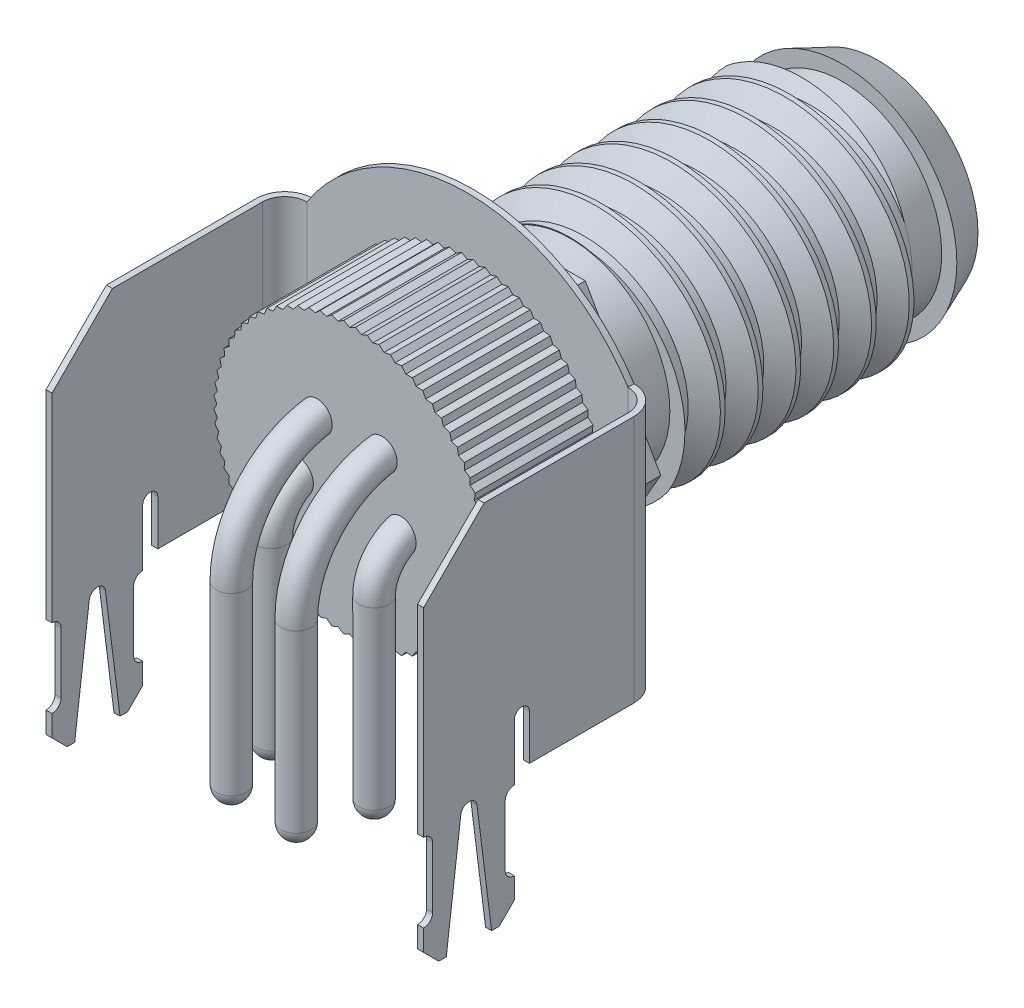
from build123d import *

# Parameters (mm, degrees)
SKETCH1_R           = 4
EXTRUDE1_DEPTH      = 8
THREAD_1_PITCH      = 1.25
SKETCH12_R          = 3.3
EXTRUDE2_DEPTH      = 1
EXTRUDE3_START      = 2
SKETCH14_R          = 3.3
EXTRUDE3_DEPTH      = 2
EXTRUDE4_DEPTH      = 1.2
BASE_FLANGE1_START  = -9
BASE_FLANGE1_DEPTH  = 15.3
EXTRUDE5_DEPTH      = 18.464893358
EXTRUDE5_DEPTH_BACK = 18.464893358
EXTRUDE6_DEPTH      = 23.019820617
EXTRUDE6_DEPTH_BACK = 23.019820617
EXTRUDE7_DEPTH      = 23.019820617
EXTRUDE7_DEPTH_BACK = 23.019820617
SKETCH28_R          = 0.5
SKETCH30_R          = 4.5
EXTRUDE8_DEPTH      = 3.9
EXTRUDE9_DEPTH      = 23.019820617
EXTRUDE9_DEPTH_BACK = 23.019820617
FILLET1_R           = 0.27
CHAMFER1_SIZE       = 2
FILLET2_R           = 0.5
FILLET3_R           = 0.5
FILLET4_R           = 0.5
FILLET5_R           = 0.5
EXTRUDE10_DEPTH     = 21.64733639
CIRPATTERN1_COUNT   = 72


# Read off the part's stored shape, not the designer's step: Base-Flange1
with BuildPart() as part:
    # Sketch1 → Extrude1 (new body)
    with BuildSketch(Plane.XY):
        Circle(SKETCH1_R)
    extrude(amount=EXTRUDE1_DEPTH)

    # 螺纹线1: the profile of Sketch5 profile screwed along a right-hand helix of 8 turns, 8 arcs to a turn; built about Z, then put on its axis
    thread_1_z = Axis((0, 0, 0), (0, 0, 1))
    thread_1_corners = [(4.0003, 0, -0.000173205), (4.0003, 0, 1.093923202), (3.323417656, 0, 0.703124998), (3.323417656, 0, 0.390624998)]
    with BuildLine(mode=Mode.PRIVATE) as thread_1_profile:
        Line(thread_1_corners[0], thread_1_corners[1])
        Line(thread_1_corners[1], thread_1_corners[2])
        Line(thread_1_corners[2], thread_1_corners[3])
        Line(thread_1_corners[3], thread_1_corners[0])
    thread_1_cap = Face(thread_1_profile.wire())
    thread_1_turn_angles = [0, 22.5, 45, 67.5, 90, 112.5, 135, 157.5, 180, 202.5, 225, 247.5, 270, 292.5, 315, 337.5, 360]
    thread_1_turn_weights = [1, 0.9238795325112867, 1, 0.9238795325112867, 1, 0.9238795325112867, 1, 0.9238795325112867, 1, 0.9238795325112867, 1, 0.9238795325112867, 1, 0.9238795325112867, 1, 0.9238795325112867, 1]
    thread_1_turn_rails = [Edge.make_bspline([Vector(p[0], p[1], 0).rotate(thread_1_z, thread_1_turn_angles[k]) / thread_1_turn_weights[k] + Vector(0, 0, p[2] + THREAD_1_PITCH * thread_1_turn_angles[k] / 360) for k in range(17)], [0, 0, 0, 1, 1, 2, 2, 3, 3, 4, 4, 5, 5, 6, 6, 7, 7, 8, 8, 8], 2, thread_1_turn_weights) for p in thread_1_corners]
    thread_1_turn_sides = [Face.make_surface_from_curves(thread_1_turn_rails[p[0]], thread_1_turn_rails[p[1]]) for p in [(0, 1), (1, 2), (2, 3), (3, 0)]]
    thread_1 = Plane(origin=(0, 0, 10), x_dir=(-1, 0, 0), z_dir=(0, 0, -1)) * Solid(Shell([*[p.moved(Location((0, 0, THREAD_1_PITCH * i))) for i in range(8) for p in thread_1_turn_sides], thread_1_cap, thread_1_cap.rotate(thread_1_z, 2880).moved(Location((0, 0, THREAD_1_PITCH * 2880 / 360)))]))
    add(thread_1, mode=Mode.SUBTRACT)

    # Sketch12 → Extrude2 (add)
    with BuildSketch(Plane(origin=(0, 0, 0), x_dir=(-1, 0, 0), z_dir=(0, 0, -1))):
        with Locations(Location((0, 0, 0), (0, 0, 180))):
            Circle(SKETCH12_R)
    extrude(amount=EXTRUDE2_DEPTH)

    # Sketch13 → Revolve1 (revolve)
    with BuildSketch(Plane(origin=(0, 0, 0), x_dir=(1, 0, 0), z_dir=(0, 1, 0)), mode=Mode.PRIVATE) as revolve1_sk:
        Polygon((0, 1), (-3.8, 1), (-3.3, 2.2), (0, 2.2), align=None)
    revolve(revolve1_sk.sketch.rotate(Axis((0, 0, -1), (0, 0, -1)), 180), axis=Axis((0, 0, -1), (0, 0, -1)))

    # Sketch14 → Extrude3 (add)
    with BuildSketch(Plane.XY.offset(8).offset(EXTRUDE3_START)):
        Circle(SKETCH14_R)
    extrude(amount=-EXTRUDE3_DEPTH)


with BuildPart() as body_2:
    # Sketch15 → Extrude4 (new body)
    with BuildSketch(Plane.XY.offset(10)):
        Polygon((2.5, 4.330127019), (-2.5, 4.330127019), (-5, 0), (-2.5, -4.330127019), (2.5, -4.330127019), (5, 0), align=None)
    extrude(amount=EXTRUDE4_DEPTH)


with BuildPart() as body_3:
    # Base-Flange1 outline → Base-Flange1 (new body)
    with BuildSketch(Plane(origin=(0, 0, 0), x_dir=(1, 0, 0), z_dir=(0, 1, 0)).offset(BASE_FLANGE1_START)):
        with BuildLine():
            Line((-6.25, -12.1366), (-6.25, -19.1))
            Line((-6.25, -19.1), (-6.05, -19.1))
            Line((-6.05, -19.1), (-6.05, -12.1366))
            ThreePointArc((-6.05, -12.1366), (-5.834254855, -11.615745145), (-5.3134, -11.4))
            Line((-5.3134, -11.4), (5.3134, -11.4))
            ThreePointArc((5.3134, -11.4), (5.834254855, -11.615745145), (6.05, -12.1366))
            Line((6.05, -12.1366), (6.05, -19.1))
            Line((6.05, -19.1), (6.25, -19.1))
            Line((6.25, -19.1), (6.25, -12.1366))
            ThreePointArc((6.25, -12.1366), (5.975676211, -11.474323789), (5.3134, -11.2))
            Line((5.3134, -11.2), (-5.3134, -11.2))
            ThreePointArc((-5.3134, -11.2), (-5.975676211, -11.474323789), (-6.25, -12.1366))
        make_face()
    extrude(amount=BASE_FLANGE1_DEPTH)

    # Sketch25 → Extrude5 (cut, two sides: drawn at the far end of the back side and taken through both)
    with BuildSketch(Plane.XY.offset(11.4).offset(-EXTRUDE5_DEPTH_BACK)):
        with BuildLine():
            Line((51.442987849, 3.384934333), (6.25, 3.384934333))
            Line((6.25, 3.384934333), (5.3134, 3.384934333))
            ThreePointArc((5.3134, 3.384934333), (0, 6.3), (-5.3134, 3.384934333))
            Line((-5.3134, 3.384934333), (-6.25, 3.384934333))
            Line((-6.25, 3.384934333), (-51.442987849, 3.384934333))
            Line((-51.442987849, 3.384934333), (-51.442987849, 93.770910031))
            Line((-51.442987849, 93.770910031), (51.442987849, 93.770910031))
            Line((51.442987849, 93.770910031), (51.442987849, 3.384934333))
        make_face()
    extrude(amount=EXTRUDE5_DEPTH + EXTRUDE5_DEPTH_BACK, mode=Mode.SUBTRACT)

    # Sketch26 → Extrude6 (cut, two sides: drawn at the far end of the back side and taken through both)
    with BuildSketch(Plane(origin=(0, 0, 0), x_dir=(0, 0, -1), z_dir=(1, 0, 0)).offset(-EXTRUDE6_DEPTH_BACK)):
        Polygon((46.506603317, -4.830127019), (-11.2, -4.830127019), (-16.1, -4.830127019), (-16.1, -9), (-16.1, -66.706603317), (65.029403958, -148.793314048), (127.636007275, -86.91683775), align=None)
    extrude(amount=EXTRUDE6_DEPTH + EXTRUDE6_DEPTH_BACK, mode=Mode.SUBTRACT)

    # Sketch27 → Extrude7 (cut, two sides: drawn at the far end of the back side and taken through both)
    with BuildSketch(Plane(origin=(0, 0, 0), x_dir=(0, 0, -1), z_dir=(1, 0, 0)).offset(-EXTRUDE7_DEPTH_BACK)):
        with BuildLine():
            Line((-16.1, -6.330127019), (-16.1, -3.330127019))
            ThreePointArc((-16.1, -3.330127019), (-15.85, -3.080127019), (-15.6, -3.330127019))
            Line((-15.6, -3.330127019), (-15.6, -6.330127019))
            ThreePointArc((-15.6, -6.330127019), (-15.85, -6.580127019), (-16.1, -6.330127019))
        make_face()
    extrude(amount=EXTRUDE7_DEPTH + EXTRUDE7_DEPTH_BACK, mode=Mode.SUBTRACT)

    # Sketch31 → Extrude9 (cut, two sides: drawn at the far end of the back side and taken through both)
    with BuildSketch(Plane(origin=(0, 0, 0), x_dir=(0, 0, -1), z_dir=(1, 0, 0)).offset(-EXTRUDE9_DEPTH_BACK)):
        Polygon((-19.1, -8.5), (-18.6, -9), (-19.1, -9), align=None)
        Polygon((-16.1, -8.5), (-16.6, -9), (-16.1, -9), align=None)
        with BuildLine():
            Line((-19.4, -7.5), (-19.4, -5.5))
            ThreePointArc((-19.4, -5.5), (-19.1, -5.2), (-18.8, -5.5))
            Line((-18.8, -5.5), (-18.8, -7.5))
            ThreePointArc((-18.8, -7.5), (-19.1, -7.8), (-19.4, -7.5))
        make_face()
        with BuildLine():
            Line((-15.8, -7.5), (-15.8, -5.5))
            ThreePointArc((-15.8, -5.5), (-16.1, -5.2), (-16.4, -5.5))
            Line((-16.4, -5.5), (-16.4, -7.5))
            ThreePointArc((-16.4, -7.5), (-16.1, -7.8), (-15.8, -7.5))
        make_face()
        Polygon((-18.35, -9), (-17.6, -3.030127019), (-16.85, -9), align=None)
    extrude(amount=EXTRUDE9_DEPTH + EXTRUDE9_DEPTH_BACK, mode=Mode.SUBTRACT)

    # Fillet1
    fillet1_edges = [body_3.edges().sort_by_distance(p)[0] for p in [
        (-6.15, -3.030127019, 17.6),
        (6.15, -3.030127019, 17.6),
    ]]
    fillet(fillet1_edges, radius=FILLET1_R)

    # Chamfer1
    chamfer1_edges = [body_3.edges().sort_by_distance(p)[0] for p in [
        (6.15, 3.384934333, 19.1),
        (-6.15, 3.384934333, 19.1),
    ]]
    chamfer(chamfer1_edges, length=CHAMFER1_SIZE)


with BuildPart() as body_4:
    # Sweep1: sweep along a path in Sketch29
    with BuildLine(Plane(origin=(0, 0, 0), x_dir=(0, 0, -1), z_dir=(1, 0, 0))) as sweep1_path:
        Line((-16.79, -8.3), (-16.79, -2))
        ThreePointArc((-16.79, -2), (-16.204213562, -0.585786438), (-14.79, 0))
        Line((-14.79, 0), (-11.4, 0))
    # Sketch28 → Sweep1 (sweep)
    with BuildSketch(Plane(origin=(0, -8.3, 0), x_dir=(1, 0, 0), z_dir=(0, 1, 0))):
        with Locations((-1.075, -18.14)):
            Circle(SKETCH28_R)
        with Locations((-1.7, -16.19)):
            Circle(SKETCH28_R)
        with Locations((1.7, -16.19)):
            Circle(SKETCH28_R)
        with Locations((1.075, -18.14)):
            Circle(SKETCH28_R)
    sweep(path=sweep1_path.line)

    # Fillet2
    fillet2_edges = [body_4.edges().sort_by_distance(p)[0] for p in [
        (0.575, -8.3, 18.14),
    ]]
    fillet(fillet2_edges, radius=FILLET2_R)

    # Fillet3
    fillet3_edges = [body_4.edges().sort_by_distance(p)[0] for p in [
        (-1.575, -8.3, 18.14),
    ]]
    fillet(fillet3_edges, radius=FILLET3_R)

    # Fillet4
    fillet4_edges = [body_4.edges().sort_by_distance(p)[0] for p in [
        (1.2, -8.3, 16.19),
    ]]
    fillet(fillet4_edges, radius=FILLET4_R)

    # Fillet5
    fillet5_edges = [body_4.edges().sort_by_distance(p)[0] for p in [
        (-2.2, -8.3, 16.19),
    ]]
    fillet(fillet5_edges, radius=FILLET5_R)


with BuildPart() as body_5:
    # Sketch30 → Extrude8 (new body)
    with BuildSketch(Plane.XY.offset(11.4)):
        with Locations(Location((0, 0, 0), (0, 0, 180))):
            Circle(SKETCH30_R)
    extrude(amount=EXTRUDE8_DEPTH)

    # Sketch32 → Extrude10 (cut, through all)
    with BuildSketch(Plane.XY.offset(15.3)):
        Polygon((4.395716997, 0), (4.495716997, 0.196287243), (4.995716997, 0.196287243), (4.995716997, -0.196287243), (4.495716997, -0.196287243), align=None)
    extrude10 = extrude(amount=-EXTRUDE10_DEPTH, mode=Mode.SUBTRACT)

    # CirPattern1: Extrude10 ×72 about axis
    cirpattern1_axis = Axis((0, 0, 0), (0, 0, 1))
    for i in range(1, CIRPATTERN1_COUNT):
        add(extrude10.rotate(cirpattern1_axis, i * 360 / CIRPATTERN1_COUNT), mode=Mode.SUBTRACT)


solid = Compound([part.part, body_2.part, body_3.part, body_4.part, body_5.part])
